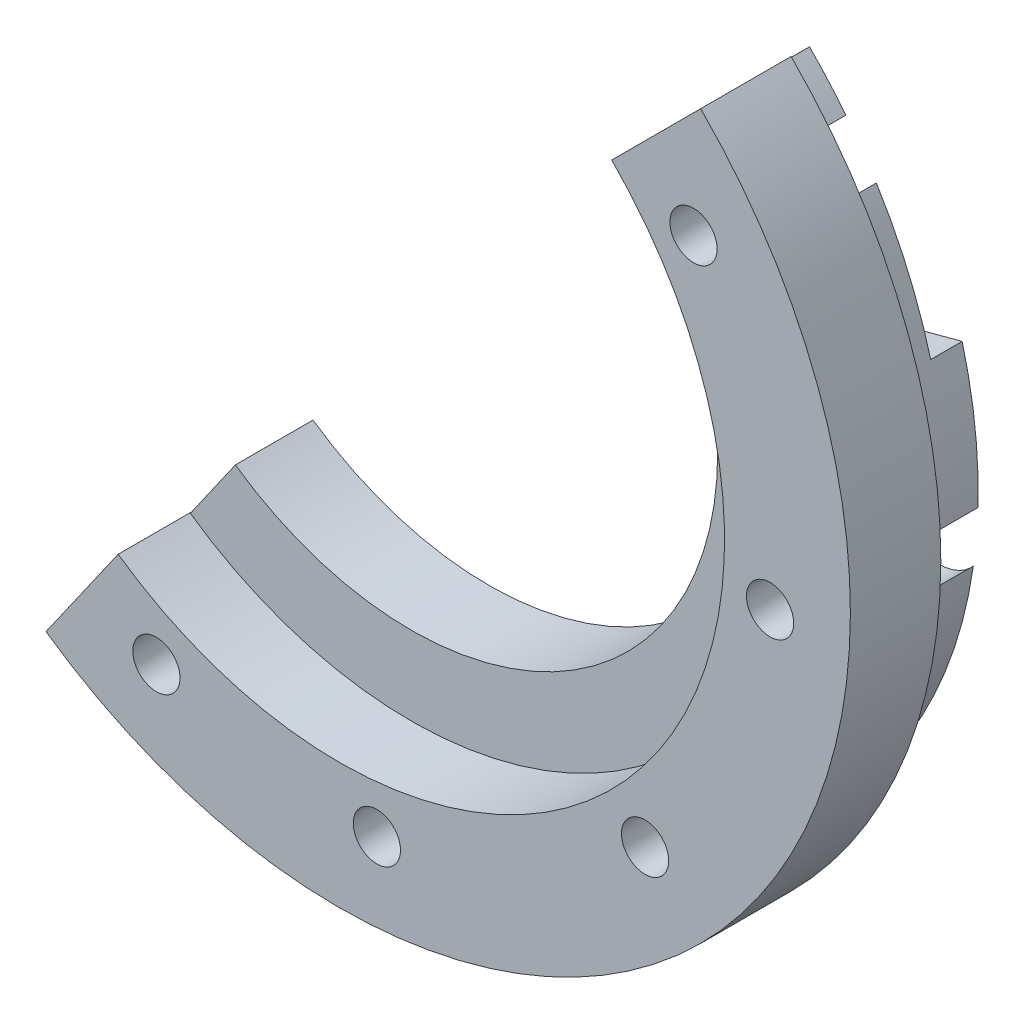
from build123d import *

# Parameters (mm, degrees)
BOSS_1_DEPTH  = 5.6
BOSS_2_DEPTH  = 4.95
CUT_3_DEPTH   = 1.1
CUT_4_DEPTH   = 1.1
CUT_5_DEPTH   = 1.1
CUT_6_DEPTH   = 1.1
CUT_7_DEPTH   = 1.7
CUT_8_DEPTH   = 1.7
CUT_9_DEPTH   = 1.9
CUT_10_DEPTH  = 2.9
S_HOLE11_R    = 1.2
HOLE_11_DEPTH = 8.8
S_HOLE12_R    = 2.3
HOLE_12_DEPTH = 3.1
S_HOLE13_R    = 1.2
HOLE_13_DEPTH = 8.8
S_HOLE14_R    = 2.3
HOLE_14_DEPTH = 3.1
S_HOLE15_R    = 1.2
HOLE_15_DEPTH = 8.8
S_HOLE16_R    = 2.3
HOLE_16_DEPTH = 3.1
S_HOLE17_R    = 1.2
HOLE_17_DEPTH = 8.8
S_HOLE18_R    = 2.3
HOLE_18_DEPTH = 3.1
S_HOLE19_R    = 1.2
HOLE_19_DEPTH = 8.8
S_HOLE20_R    = 2.3
HOLE_20_DEPTH = 3.1


with BuildPart() as part:
    # S_prism1 → Boss_1 (new body)
    with BuildSketch(Plane.XY.offset(24.6)):
        with BuildLine():
            Line((-14.912987345, -21.297953152), (-11.242098152, -16.055380068))
            ThreePointArc((-11.242098152, -16.055380068), (15.014471085, -12.59863715), (13.859292911, 13.859292911))
            Line((13.859292911, 13.859292911), (18.384776311, 18.384776311))
            ThreePointArc((18.384776311, 18.384776311), (19.917155521, -16.712477852), (-14.912987345, -21.297953152))
        make_face()
    extrude(amount=BOSS_1_DEPTH)

    # S_prism2 → Boss_2 (add)
    with BuildSketch(Plane.XY.offset(21.6)):
        with BuildLine():
            Line((-13.68454789, -19.594467307), (-8.932173518, -12.789694142))
            ThreePointArc((-8.932173518, -12.789694142), (11.950293313, -10.027486711), (11.044334296, 11.017380812))
            Line((11.044334296, 11.017380812), (16.920486517, 16.879192399))
            ThreePointArc((16.920486517, 16.879192399), (18.308462191, -15.362623872), (-13.68454789, -19.594467307))
        make_face()
    extrude(amount=BOSS_2_DEPTH)

    # S_pcut3 → Cut_3 (cut)
    with BuildSketch(Plane.XY.offset(24.5)):
        with BuildLine():
            Line((-15.39997361, -21.196245253), (-14.04806753, -19.335506166))
            ThreePointArc((-14.04806753, -19.335506166), (18.308462191, -15.362623872), (16.602335054, 17.192221228))
            Line((16.602335054, 17.192221228), (18.200049306, 18.846702769))
            ThreePointArc((18.200049306, 18.846702769), (20.07036441, -16.841035374), (-15.39997361, -21.196245253))
        make_face()
    extrude(amount=CUT_3_DEPTH, mode=Mode.SUBTRACT)

    # S_pcut4 → Cut_4 (cut)
    with BuildSketch(Plane.XY.offset(21.5)):
        with BuildLine():
            Line((-9.992349289, -13.753288904), (-9.110671411, -12.539763413))
            ThreePointArc((-9.110671411, -12.539763413), (11.873688868, -9.96320795), (10.767204742, 11.149766905))
            Line((10.767204742, 11.149766905), (11.809192298, 12.228776606))
            ThreePointArc((11.809192298, 12.228776606), (13.022755533, -10.927389365), (-9.992349289, -13.753288904))
        make_face()
    extrude(amount=CUT_4_DEPTH, mode=Mode.SUBTRACT)

    # S_pcut5 → Cut_5 (cut)
    with BuildSketch(Plane.XY.offset(21.5)):
        with BuildLine():
            Line((-10.697691592, -14.724109298), (-9.110671411, -12.539763413))
            ThreePointArc((-9.110671411, -12.539763413), (-0.811207322, -15.478757789), (7.75, -13.423393759))
            Line((7.75, -13.423393759), (9.1, -15.761662349))
            ThreePointArc((9.1, -15.761662349), (-0.952514404, -18.175057533), (-10.697691592, -14.724109298))
        make_face()
    extrude(amount=CUT_5_DEPTH, mode=Mode.SUBTRACT)

    # S_pcut6 → Cut_6 (cut)
    with BuildSketch(Plane.XY.offset(21.5)):
        with BuildLine():
            Line((18.545775865, 4.969325666), (14.971850307, 4.011695199))
            ThreePointArc((14.971850307, 4.011695199), (13.355251987, 7.866844626), (10.767204742, 11.149766905))
            Line((10.767204742, 11.149766905), (13.337440713, 13.811324167))
            ThreePointArc((13.337440713, 13.811324167), (16.54327988, 9.744736569), (18.545775865, 4.969325666))
        make_face()
    extrude(amount=CUT_6_DEPTH, mode=Mode.SUBTRACT)

    # S_pcut7 → Cut_7 (cut)
    with BuildSketch(Plane.XY.offset(21.5)):
        with BuildLine():
            Line((25.307256649, 6.781058982), (19.608294274, 5.254026616))
            ThreePointArc((19.608294274, 5.254026616), (17.491071957, 10.303028768), (14.10156492, 14.602597947))
            Line((14.10156492, 14.602597947), (18.200049306, 18.846702769))
            ThreePointArc((18.200049306, 18.846702769), (22.574684004, 13.29750511), (25.307256649, 6.781058982))
        make_face()
    extrude(amount=CUT_7_DEPTH, mode=Mode.SUBTRACT)

    # S_pcut8 → Cut_8 (cut)
    with BuildSketch(Plane.XY.offset(21.5)):
        with BuildLine():
            Line((-15.39997361, -21.196245253), (-11.932040622, -16.423044986))
            ThreePointArc((-11.932040622, -16.423044986), (-1.062419912, -20.272179556), (10.15, -17.580315697))
            Line((10.15, -17.580315697), (13.1, -22.689865579))
            ThreePointArc((13.1, -22.689865579), (-1.371202054, -26.164093811), (-15.39997361, -21.196245253))
        make_face()
    extrude(amount=CUT_8_DEPTH, mode=Mode.SUBTRACT)

    # S_pcut9 → Cut_9 (cut)
    with BuildSketch(Plane.XY.offset(21.5)):
        with BuildLine():
            Line((-15.39997361, -21.196245253), (-11.932040622, -16.423044986))
            ThreePointArc((-11.932040622, -16.423044986), (-8.739375265, -18.322481272), (-5.254026616, -19.608294274))
            Line((-5.254026616, -19.608294274), (-6.781058982, -25.307256649))
            ThreePointArc((-6.781058982, -25.307256649), (-11.279390736, -23.64773445), (-15.39997361, -21.196245253))
        make_face()
    extrude(amount=CUT_9_DEPTH, mode=Mode.SUBTRACT)

    # S_pcut10 → Cut_10 (cut)
    with BuildSketch(Plane.XY.offset(21.5)):
        with BuildLine():
            Line((-15.39997361, -21.196245253), (-12.519825874, -17.23206198))
            ThreePointArc((-12.519825874, -17.23206198), (-10.326444911, -18.629399762), (-7.97912044, -19.749016102))
            Line((-7.97912044, -19.749016102), (-9.814692747, -24.29221699))
            ThreePointArc((-9.814692747, -24.29221699), (-12.70201205, -22.915036327), (-15.39997361, -21.196245253))
        make_face()
    extrude(amount=CUT_10_DEPTH, mode=Mode.SUBTRACT)

    # S_hole11 → Hole_11 (cut)
    with BuildSketch(Plane.XY.offset(21.5)):
        with Locations((18.021344974, 12.6186816)):
            Circle(S_HOLE11_R)
    extrude(amount=HOLE_11_DEPTH, mode=Mode.SUBTRACT)

    # S_hole12 → Hole_12 (cut)
    with BuildSketch(Plane.XY.offset(21.5)):
        with Locations((18.021344974, 12.6186816)):
            Circle(S_HOLE12_R)
    extrude(amount=HOLE_12_DEPTH, mode=Mode.SUBTRACT)

    # S_hole13 → Hole_13 (cut)
    with BuildSketch(Plane.XY.offset(21.5)):
        with Locations((21.916283358, -1.91742634)):
            Circle(S_HOLE13_R)
    extrude(amount=HOLE_13_DEPTH, mode=Mode.SUBTRACT)

    # S_hole14 → Hole_14 (cut)
    with BuildSketch(Plane.XY.offset(21.5)):
        with Locations((21.916283358, -1.91742634)):
            Circle(S_HOLE14_R)
    extrude(amount=HOLE_14_DEPTH, mode=Mode.SUBTRACT)

    # S_hole15 → Hole_15 (cut)
    with BuildSketch(Plane.XY.offset(21.5)):
        with Locations((15.556349186, -15.556349186)):
            Circle(S_HOLE15_R)
    extrude(amount=HOLE_15_DEPTH, mode=Mode.SUBTRACT)

    # S_hole16 → Hole_16 (cut)
    with BuildSketch(Plane.XY.offset(21.5)):
        with Locations((15.556349186, -15.556349186)):
            Circle(S_HOLE16_R)
    extrude(amount=HOLE_16_DEPTH, mode=Mode.SUBTRACT)

    # S_hole17 → Hole_17 (cut)
    with BuildSketch(Plane.XY.offset(21.5)):
        with Locations((1.91742634, -21.916283358)):
            Circle(S_HOLE17_R)
    extrude(amount=HOLE_17_DEPTH, mode=Mode.SUBTRACT)

    # S_hole18 → Hole_18 (cut)
    with BuildSketch(Plane.XY.offset(21.5)):
        with Locations((1.91742634, -21.916283358)):
            Circle(S_HOLE18_R)
    extrude(amount=HOLE_18_DEPTH, mode=Mode.SUBTRACT)

    # S_hole19 → Hole_19 (cut)
    with BuildSketch(Plane.XY.offset(21.5)):
        with Locations((-9.297601758, -19.938771315)):
            Circle(S_HOLE19_R)
    extrude(amount=HOLE_19_DEPTH, mode=Mode.SUBTRACT)

    # S_hole20 → Hole_20 (cut)
    with BuildSketch(Plane.XY.offset(21.5)):
        with Locations((-9.297601758, -19.938771315)):
            Circle(S_HOLE20_R)
    extrude(amount=HOLE_20_DEPTH, mode=Mode.SUBTRACT)


solid = part.part
